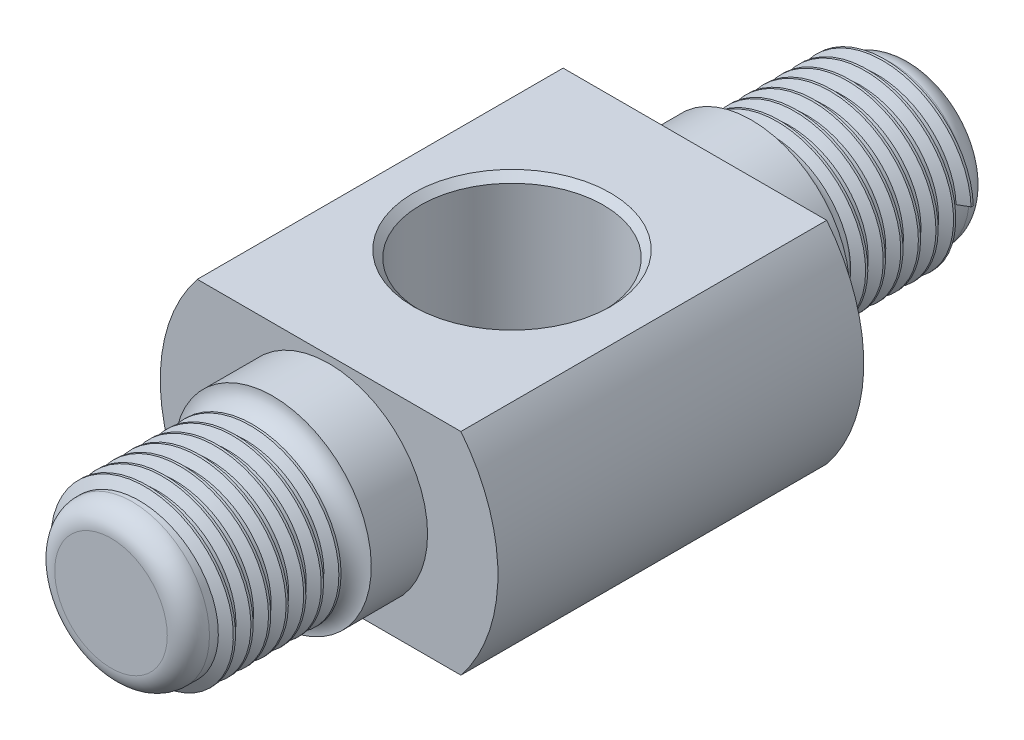
from build123d import *

# Parameters (mm, degrees)
BOSS_EXTRUDE1_DEPTH        = 26
F_13_0_13_DIAMETER_HOLE1_D = 13
CHAMFER2_SIZE              = 0.5
SKETCH25_R                 = 7
BOSS_EXTRUDE2_DEPTH        = 4
SKETCH26_R                 = 5.5
BOSS_EXTRUDE3_DEPTH        = 11.5
FILLET1_R                  = 1.5
FILLET2_R                  = 1.5
THREAD2_PITCH              = 1.25
FILLET1_OF_MIRROR2_R       = 1.5
FILLET2_OF_MIRROR2_R       = 1.5
THREAD3_PITCH              = 1.25


with BuildPart() as part:
    # Sketch1 → Boss-Extrude1 (new body)
    with BuildSketch(Plane.XY):
        with BuildLine():
            Line((-9.367496998, -7.5), (9.367496998, -7.5))
            ThreePointArc((9.367496998, -7.5), (12, 0), (9.367496998, 7.5))
            Line((9.367496998, 7.5), (-9.367496998, 7.5))
            ThreePointArc((-9.367496998, 7.5), (-12, 0), (-9.367496998, -7.5))
        make_face()
    extrude(amount=BOSS_EXTRUDE1_DEPTH)

    # Ø13.0 (13) Diameter Hole1 (through all)
    with Locations(Plane(origin=(0, 7.5, 13), x_dir=(1, 0, 0), z_dir=(0, 1, 0))):
        with Locations((0, 0)):
            Hole(F_13_0_13_DIAMETER_HOLE1_D / 2)

    # Chamfer2
    chamfer2_edges = [part.edges().sort_by_distance(p)[0] for p in [
        (6.5, 7.5, 13),
        (6.5, -7.5, 13),
    ]]
    chamfer(chamfer2_edges, length=CHAMFER2_SIZE)

    # Sketch25 → Boss-Extrude2 (add)
    with BuildSketch(Plane(origin=(0, 0, 0), x_dir=(-1, 0, 0), z_dir=(0, 0, -1))):
        Circle(SKETCH25_R)
    boss_extrude2 = extrude(amount=BOSS_EXTRUDE2_DEPTH)

    # Sketch26 → Boss-Extrude3 (add)
    with BuildSketch(Plane(origin=(0, 0, -4), x_dir=(-1, 0, 0), z_dir=(0, 0, -1))):
        Circle(SKETCH26_R)
    boss_extrude3 = extrude(amount=BOSS_EXTRUDE3_DEPTH)

    # Fillet1
    fillet1_edges = [part.edges().sort_by_distance(p)[0] for p in [
        (5.5, 0, -4),
    ]]
    fillet(fillet1_edges, radius=FILLET1_R - 0.0001)  # a hair under: the kernel refuses the full size

    # Fillet2
    fillet2_edges = [part.edges().sort_by_distance(p)[0] for p in [
        (5.5, 0, -15.5),
    ]]
    fillet(fillet2_edges, radius=FILLET2_R)

    # Thread2: the profile of Thread Profile2 profile screwed along a right-hand helix of 6.8 turns, 8 arcs to a turn; built about Z, then put on its axis
    thread2_z = Axis((0, 0, 0), (0, 0, 1))
    thread2_corners = [(5.4997, 0, -0.000173205), (6.176582344, 0, 0.390624998), (6.176582344, 0, 0.546874998), (5.4997, 0, 0.937673202)]
    with BuildLine(mode=Mode.PRIVATE) as thread2_profile:
        Line(thread2_corners[0], thread2_corners[1])
        Line(thread2_corners[1], thread2_corners[2])
        Line(thread2_corners[2], thread2_corners[3])
        Line(thread2_corners[3], thread2_corners[0])
    thread2_cap = Face(thread2_profile.wire())
    thread2_turn_angles = [0, 22.5, 45, 67.5, 90, 112.5, 135, 157.5, 180, 202.5, 225, 247.5, 270, 292.5, 315, 337.5, 360]
    thread2_turn_weights = [1, 0.9238795325112867, 1, 0.9238795325112867, 1, 0.9238795325112867, 1, 0.9238795325112867, 1, 0.9238795325112867, 1, 0.9238795325112867, 1, 0.9238795325112867, 1, 0.9238795325112867, 1]
    thread2_turn_rails = [Edge.make_bspline([Vector(p[0], p[1], 0).rotate(thread2_z, thread2_turn_angles[k]) / thread2_turn_weights[k] + Vector(0, 0, p[2] + THREAD2_PITCH * thread2_turn_angles[k] / 360) for k in range(17)], [0, 0, 0, 1, 1, 2, 2, 3, 3, 4, 4, 5, 5, 6, 6, 7, 7, 8, 8, 8], 2, thread2_turn_weights) for p in thread2_corners]
    thread2_turn_sides = [Face.make_surface_from_curves(thread2_turn_rails[p[0]], thread2_turn_rails[p[1]]) for p in [(0, 1), (1, 2), (2, 3), (3, 0)]]
    thread2_last_angles = [2160, 2182.5, 2205, 2227.5, 2250, 2272.5, 2295, 2317.5, 2340, 2362.5, 2385, 2407.5, 2430, 2439, 2448]
    thread2_last_weights = [1, 0.9238795325112867, 1, 0.9238795325112867, 1, 0.9238795325112867, 1, 0.9238795325112867, 1, 0.9238795325112867, 1, 0.9238795325112867, 1, 0.9876883405951378, 1]
    thread2_last_rails = [Edge.make_bspline([Vector(p[0], p[1], 0).rotate(thread2_z, thread2_last_angles[k]) / thread2_last_weights[k] + Vector(0, 0, p[2] + THREAD2_PITCH * thread2_last_angles[k] / 360) for k in range(15)], [0, 0, 0, 1, 1, 2, 2, 3, 3, 4, 4, 5, 5, 6, 6, 7, 7, 7], 2, thread2_last_weights) for p in thread2_corners]
    thread2_last_sides = [Face.make_surface_from_curves(thread2_last_rails[p[0]], thread2_last_rails[p[1]]) for p in [(0, 1), (1, 2), (2, 3), (3, 0)]]
    thread2 = Plane(origin=(0, 0, -14), x_dir=(1, 0, 0), z_dir=(0, 0, 1)) * Solid(Shell([*[p.moved(Location((0, 0, THREAD2_PITCH * i))) for i in range(6) for p in thread2_turn_sides], *thread2_last_sides, thread2_cap, thread2_cap.rotate(thread2_z, 2448).moved(Location((0, 0, THREAD2_PITCH * 2448 / 360)))]))
    add(thread2)

    # Mirror2: Boss-Extrude2, Boss-Extrude3 across plane
    add(boss_extrude2.mirror(Plane(origin=(0, 0, 13), x_dir=(1, 0, 0), z_dir=(0, 0, -1))))
    add(boss_extrude3.mirror(Plane(origin=(0, 0, 13), x_dir=(1, 0, 0), z_dir=(0, 0, -1))))

    # Fillet1 of Mirror2
    fillet1_of_mirror2_edges = [part.edges().sort_by_distance(p)[0] for p in [
        (5.5, 0, 30),
    ]]
    fillet(fillet1_of_mirror2_edges, radius=FILLET1_OF_MIRROR2_R - 0.0001)  # a hair under: the kernel refuses the full size

    # Fillet2 of Mirror2
    fillet2_of_mirror2_edges = [part.edges().sort_by_distance(p)[0] for p in [
        (5.5, 0, 41.5),
    ]]
    fillet(fillet2_of_mirror2_edges, radius=FILLET2_OF_MIRROR2_R)

    # Thread3: the profile of Thread Profile3 profile screwed along a right-hand helix of 6.8 turns, 8 arcs to a turn; built about Z, then put on its axis
    thread3_z = Axis((0, 0, 0), (0, 0, 1))
    thread3_corners = [(5.4997, 0, -0.000173205), (6.176582344, 0, 0.390624998), (6.176582344, 0, 0.546874998), (5.4997, 0, 0.937673202)]
    with BuildLine(mode=Mode.PRIVATE) as thread3_profile:
        Line(thread3_corners[0], thread3_corners[1])
        Line(thread3_corners[1], thread3_corners[2])
        Line(thread3_corners[2], thread3_corners[3])
        Line(thread3_corners[3], thread3_corners[0])
    thread3_cap = Face(thread3_profile.wire())
    thread3_turn_angles = [0, 22.5, 45, 67.5, 90, 112.5, 135, 157.5, 180, 202.5, 225, 247.5, 270, 292.5, 315, 337.5, 360]
    thread3_turn_weights = [1, 0.9238795325112867, 1, 0.9238795325112867, 1, 0.9238795325112867, 1, 0.9238795325112867, 1, 0.9238795325112867, 1, 0.9238795325112867, 1, 0.9238795325112867, 1, 0.9238795325112867, 1]
    thread3_turn_rails = [Edge.make_bspline([Vector(p[0], p[1], 0).rotate(thread3_z, thread3_turn_angles[k]) / thread3_turn_weights[k] + Vector(0, 0, p[2] + THREAD3_PITCH * thread3_turn_angles[k] / 360) for k in range(17)], [0, 0, 0, 1, 1, 2, 2, 3, 3, 4, 4, 5, 5, 6, 6, 7, 7, 8, 8, 8], 2, thread3_turn_weights) for p in thread3_corners]
    thread3_turn_sides = [Face.make_surface_from_curves(thread3_turn_rails[p[0]], thread3_turn_rails[p[1]]) for p in [(0, 1), (1, 2), (2, 3), (3, 0)]]
    thread3_last_angles = [2160, 2182.5, 2205, 2227.5, 2250, 2272.5, 2295, 2317.5, 2340, 2362.5, 2385, 2407.5, 2430, 2439, 2448]
    thread3_last_weights = [1, 0.9238795325112867, 1, 0.9238795325112867, 1, 0.9238795325112867, 1, 0.9238795325112867, 1, 0.9238795325112867, 1, 0.9238795325112867, 1, 0.9876883405951409, 1]
    thread3_last_rails = [Edge.make_bspline([Vector(p[0], p[1], 0).rotate(thread3_z, thread3_last_angles[k]) / thread3_last_weights[k] + Vector(0, 0, p[2] + THREAD3_PITCH * thread3_last_angles[k] / 360) for k in range(15)], [0, 0, 0, 1, 1, 2, 2, 3, 3, 4, 4, 5, 5, 6, 6, 7, 7, 7], 2, thread3_last_weights) for p in thread3_corners]
    thread3_last_sides = [Face.make_surface_from_curves(thread3_last_rails[p[0]], thread3_last_rails[p[1]]) for p in [(0, 1), (1, 2), (2, 3), (3, 0)]]
    thread3 = Plane(origin=(0, 0, 40), x_dir=(-1, 0, 0), z_dir=(0, 0, -1)) * Solid(Shell([*[p.moved(Location((0, 0, THREAD3_PITCH * i))) for i in range(6) for p in thread3_turn_sides], *thread3_last_sides, thread3_cap, thread3_cap.rotate(thread3_z, 2448).moved(Location((0, 0, THREAD3_PITCH * 2448 / 360)))]))
    add(thread3)


solid = part.part
